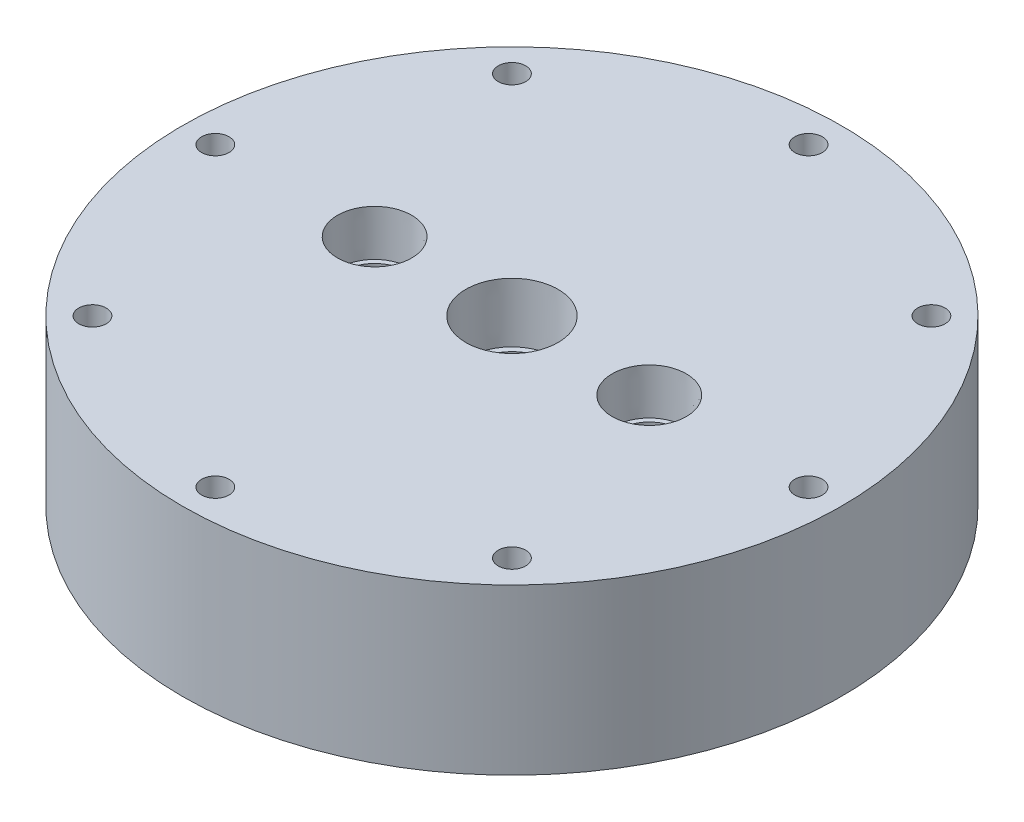
from build123d import *

# Parameters (mm, degrees)
SKETCH1_R                                      = 76.2
BILLET_DEPTH                                   = 50.8
SKETCH3_R                                      = 19.05
LOX_PLATE_DEPTH                                = 13.97
SKETCH5_R                                      = 13.97
LOX_DOME_DEPTH                                 = 20.32
SKETCH7_R                                      = 76.2
TOP_MILL_DEPTH                                 = 12.7
F_1_4_BOLT_HOLE_REACH                          = 116.3
SKETCH11_R                                     = 3.175
BOLT_PATTERN_COUNT                             = 8
SKETCH12_R                                     = 60.96
KEROSENE_PLATE_DEPTH                           = 10.16
SKETCH26_R                                     = 17.78
SKETCH26_R_2                                   = 16.51
LOX_PLATE_O_RING_DEPTH                         = 1.27
KEROSENE_INLET_3_8_NPT_TAPPED_HOLE1_AT_2_COUNT = 2
KEROSENE_INLET_3_8_NPT_TAPPED_HOLE1_AT_2_PITCH = 63.5


with BuildPart() as part:
    # Sketch1 → Billet (new body)
    with BuildSketch(Plane(origin=(0, 0, 0), x_dir=(1, 0, 0), z_dir=(0, 1, 0))):
        Circle(SKETCH1_R)
    extrude(amount=-BILLET_DEPTH)

    # Sketch3 → Lox Plate (cut)
    with BuildSketch(Plane(origin=(0, -50.8, 0), x_dir=(1, 0, 0), z_dir=(0, 1, 0))):
        Circle(SKETCH3_R)
    extrude(amount=LOX_PLATE_DEPTH, mode=Mode.SUBTRACT)

    # Sketch5 → Lox Dome (cut)
    with BuildSketch(Plane(origin=(0, -50.8, 0), x_dir=(1, 0, 0), z_dir=(0, 1, 0))):
        Circle(SKETCH5_R)
    extrude(amount=LOX_DOME_DEPTH, mode=Mode.SUBTRACT)

    # Sketch7 → Top Mill (cut)
    with BuildSketch(Plane(origin=(0, 0, 0), x_dir=(1, 0, 0), z_dir=(0, 1, 0))):
        Circle(SKETCH7_R)
    extrude(amount=-TOP_MILL_DEPTH, mode=Mode.SUBTRACT)

    # Sketch11 → 1/4" Bolt Hole (cut, up to next)
    with BuildSketch(Plane(origin=(0, -50.8, 0), x_dir=(1, 0, 0), z_dir=(0, 1, 0)), mode=Mode.PRIVATE) as f_1_4_bolt_hole_sk1:
        with Locations((0, 68.58)):
            Circle(SKETCH11_R)
    f_1_4_bolt_hole_tool1 = extrude(f_1_4_bolt_hole_sk1.sketch, amount=F_1_4_BOLT_HOLE_REACH, mode=Mode.PRIVATE) & part.part
    f_1_4_bolt_hole = f_1_4_bolt_hole_tool1.solids().sort_by_distance((0, -50.8, -68.58))[0]
    add(f_1_4_bolt_hole, mode=Mode.SUBTRACT)

    # Bolt Pattern: 1/4" Bolt Hole ×8 about axis
    bolt_pattern_axis = Axis((0, 53.34, 0), (0, -1, 0))
    for i in range(1, BOLT_PATTERN_COUNT):
        add(f_1_4_bolt_hole.rotate(bolt_pattern_axis, i * 360 / BOLT_PATTERN_COUNT), mode=Mode.SUBTRACT)

    # Sketch12 → Kerosene Plate (cut)
    with BuildSketch(Plane(origin=(0, -50.8, 0), x_dir=(1, 0, 0), z_dir=(0, 1, 0))):
        Circle(SKETCH12_R)
    extrude(amount=KEROSENE_PLATE_DEPTH, mode=Mode.SUBTRACT)

    # Sketch21 → Lox Inlet-1/2 NPT Tapped Hole3 (revolve, cut)
    with BuildSketch(Plane(origin=(0, -12.7, 0), x_dir=(0, 0, 1), z_dir=(1, 0, 0))):
        Polygon((0, 0), (0, 38.1), (8.9281, 38.1), (8.9281, 13.462), (10.261665792, 13.462), (10.6647361, 0), align=None)
    revolve(axis=Axis((0, -6.35, 0), (0, -1, 0)), mode=Mode.SUBTRACT)

    # Sketch26 → Lox Plate O Ring (cut)
    with BuildSketch(Plane.XZ.offset(36.83)):
        Circle(SKETCH26_R)
        Circle(SKETCH26_R_2, mode=Mode.SUBTRACT)
    extrude(amount=-LOX_PLATE_O_RING_DEPTH, mode=Mode.SUBTRACT)

    # Sketch25 → Kerosene Inlet-3/8 NPT Tapped Hole1 (revolve, cut)
    with BuildSketch(Plane(origin=(-31.75, -12.7, 0), x_dir=(0, 0, 1), z_dir=(1, 0, 0))):
        Polygon((0, 0), (0, 38.1), (7.1374, 38.1), (7.1374, 10.414), (8.263205494, 10.414), (8.5750146, 0), align=None)
    kerosene_inlet_3_8_npt_tapped_hole1 = revolve(axis=Axis((-31.75, -6.35, 0), (0, -1, 0)), mode=Mode.SUBTRACT)

    # Kerosene Inlet-3/8 NPT Tapped Hole1 at 2: Kerosene Inlet-3/8 NPT Tapped Hole1 ×2
    with Locations(*[(i * KEROSENE_INLET_3_8_NPT_TAPPED_HOLE1_AT_2_PITCH, 0, 0) for i in range(1, KEROSENE_INLET_3_8_NPT_TAPPED_HOLE1_AT_2_COUNT)]):
        add(kerosene_inlet_3_8_npt_tapped_hole1, mode=Mode.SUBTRACT)


solid = part.part
